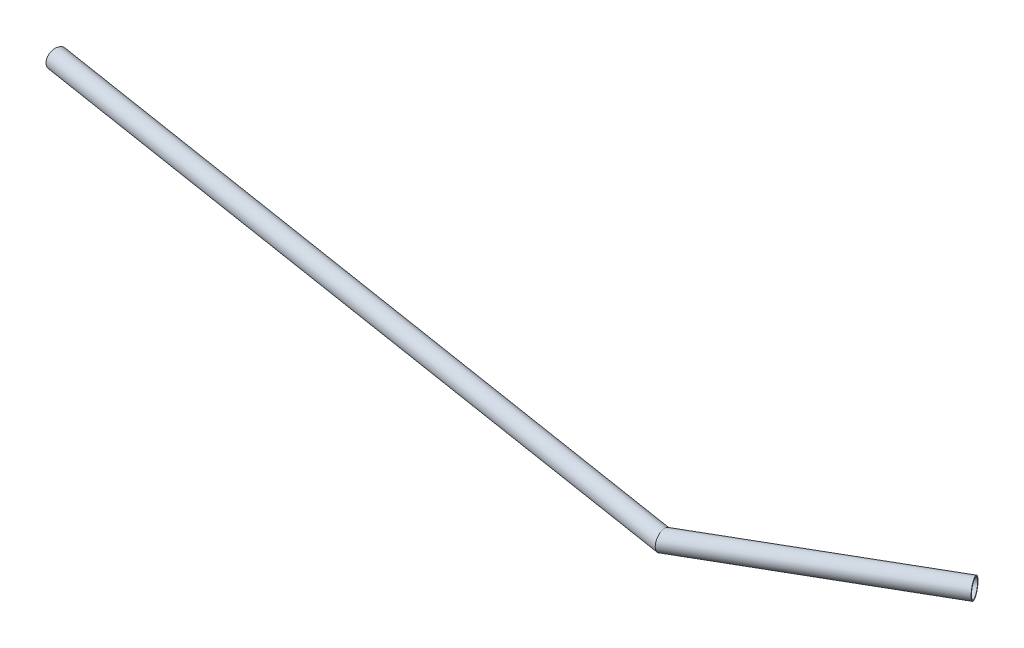
from build123d import *

# Parameters (mm, degrees)
SKETCH2_R   = 9.525
SKETCH2_R_2 = 8.525


with BuildPart() as part:
    # Sweep-Thin1: sweep along a path in Sketch1
    with BuildLine(Plane(origin=(0, 0, 0), x_dir=(1, 0, 0), z_dir=(0, 1, 0))) as sweep_thin1_path:
        Line((465, 0), (265, -115.470053838))
        Line((265, -115.470053838), (-465, 0))
    # Sketch2 → Sweep-Thin1 (sweep)
    with BuildSketch(Plane(origin=(-465, 0, 0), x_dir=(0.15623569684946048, 0, -0.9877198018820741), z_dir=(0.9877198018820741, 0, 0.15623569684946048))):
        Circle(SKETCH2_R)
        Circle(SKETCH2_R_2, mode=Mode.SUBTRACT)
    sweep(path=sweep_thin1_path.line, transition=Transition.RIGHT)


solid = part.part
